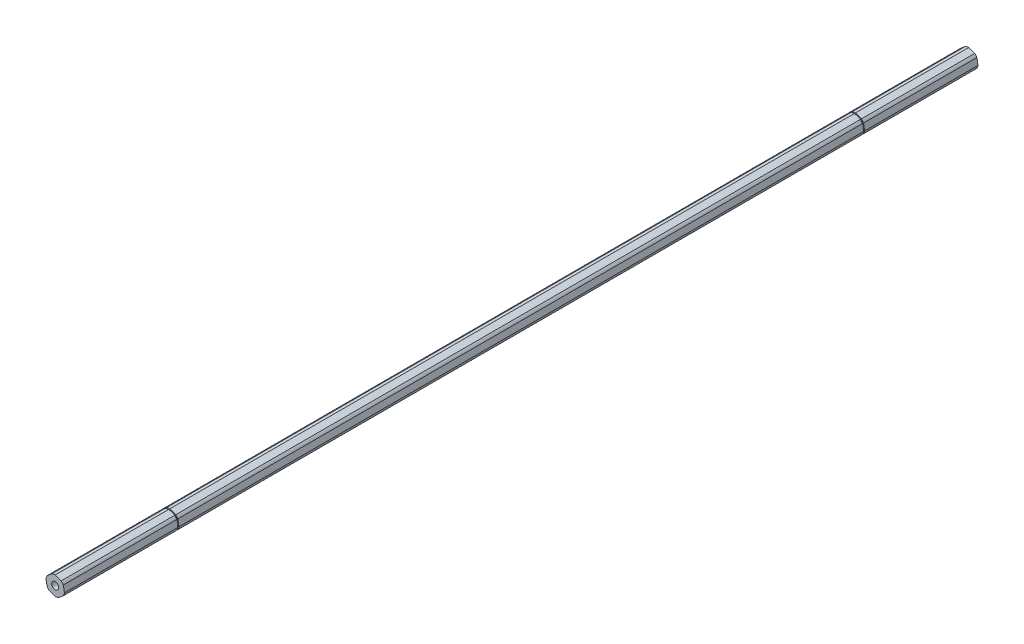
from build123d import *

# Parameters (mm, degrees)
BOSS_EXTRUDE1_DEPTH         = 329.4507
SKETCH2_R                   = 2.0193
CUT_EXTRUDE1_DEPTH          = 659.969574666
F_1_4_20_TAPPED_HOLE1_D     = 5.1054
F_1_4_20_TAPPED_HOLE1_DEPTH = 19.05
F_1_4_20_TAPPED_HOLE1_TIP   = 1.533816902
F_1_4_20_TAPPED_HOLE2_D     = 5.1054
F_1_4_20_TAPPED_HOLE2_DEPTH = 19.05
F_1_4_20_TAPPED_HOLE2_TIP   = 1.533816902
SKETCH10_W                  = 0.889
SKETCH10_H                  = 0.8064


with BuildPart() as part:
    # Sketch1 → Boss-Extrude1 (new, symmetric)
    with BuildSketch(Plane.XY):
        with BuildLine():
            Line((-6.654540832, 1.131188008), (-5.845671476, -3.375))
            ThreePointArc((-5.845671476, -3.375), (-5.15742276, -4.354709), (-4.306907968, -5.197407407))
            Line((-4.306907968, -5.197407407), (0, -6.75))
            ThreePointArc((0, -6.75), (1.19257724, -6.643813628), (2.347632865, -6.328595415))
            Line((2.347632865, -6.328595415), (5.845671476, -3.375))
            ThreePointArc((5.845671476, -3.375), (6.35, -2.289104628), (6.654540832, -1.131188008))
            Line((6.654540832, -1.131188008), (5.845671476, 3.375))
            ThreePointArc((5.845671476, 3.375), (5.15742276, 4.354709), (4.306907968, 5.197407407))
            Line((4.306907968, 5.197407407), (0, 6.75))
            ThreePointArc((0, 6.75), (-1.19257724, 6.643813628), (-2.347632865, 6.328595415))
            Line((-2.347632865, 6.328595415), (-5.845671476, 3.375))
            ThreePointArc((-5.845671476, 3.375), (-6.35, 2.289104628), (-6.654540832, 1.131188008))
        make_face()
    extrude(amount=BOSS_EXTRUDE1_DEPTH, both=True)

    # Sketch2 → Cut-Extrude1 (cut, through all)
    with BuildSketch(Plane.XY.offset(329.4507)):
        Circle(SKETCH2_R)
    extrude(amount=-CUT_EXTRUDE1_DEPTH, mode=Mode.SUBTRACT)

    # 1/4-20 Tapped Hole1
    with Locations(Plane.XY.offset(329.4507)):
        with Locations((0, 0)):
            Hole(F_1_4_20_TAPPED_HOLE1_D / 2, depth=F_1_4_20_TAPPED_HOLE1_DEPTH)
            with Locations((0, 0, -(F_1_4_20_TAPPED_HOLE1_DEPTH + F_1_4_20_TAPPED_HOLE1_TIP / 2))):  # 118° drill point
                Cone(0, F_1_4_20_TAPPED_HOLE1_D / 2, F_1_4_20_TAPPED_HOLE1_TIP, mode=Mode.SUBTRACT)

    # 1/4-20 Tapped Hole2
    with Locations(Plane(origin=(0, 0, -329.4507), x_dir=(-1, 0, 0), z_dir=(0, 0, -1))):
        with Locations((0, 0)):
            Hole(F_1_4_20_TAPPED_HOLE2_D / 2, depth=F_1_4_20_TAPPED_HOLE2_DEPTH)
            with Locations((0, 0, -(F_1_4_20_TAPPED_HOLE2_DEPTH + F_1_4_20_TAPPED_HOLE2_TIP / 2))):  # 118° drill point
                Cone(0, F_1_4_20_TAPPED_HOLE2_D / 2, F_1_4_20_TAPPED_HOLE2_TIP, mode=Mode.SUBTRACT)

    # Sketch10 → Cut-Revolve1 (revolve, cut)
    with BuildSketch(Plane(origin=(0, 0.565400242, 0), x_dir=(0, 0, -1), z_dir=(1, 0, 0))):
        with Locations((247.269, 5.781399758)):
            Rectangle(SKETCH10_W, SKETCH10_H)
    cut_revolve1 = revolve(axis=Axis((0, 0, 0), (0, 0, 1)), mode=Mode.SUBTRACT)

    # Mirror1: Cut-Revolve1 across plane
    add(cut_revolve1.mirror(Plane.XY), mode=Mode.SUBTRACT)


solid = part.part
